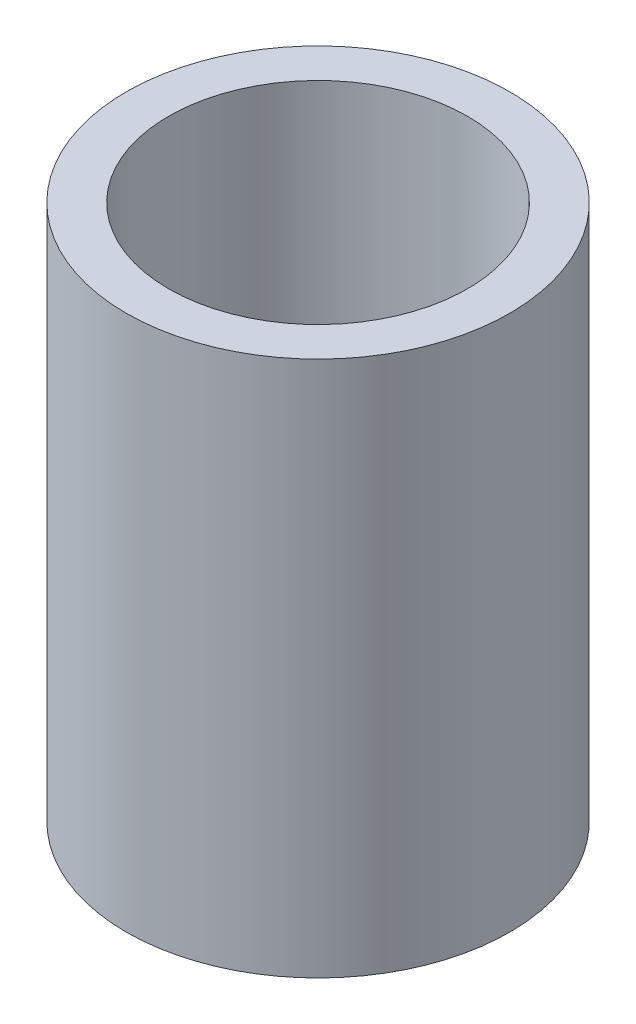
from build123d import *

# Parameters (mm, degrees)
SKETCH1_R           = 22.5
BOSS_EXTRUDE1_DEPTH = 62.876562951
SKETCH2_R           = 17.535425343
CUT_EXTRUDE1_DEPTH  = 71.469583286


with BuildPart() as part:
    # Sketch1 → Boss-Extrude1 (new body)
    with BuildSketch(Plane(origin=(0, 0, 0), x_dir=(1, 0, 0), z_dir=(0, 1, 0))):
        Circle(SKETCH1_R)
    extrude(amount=BOSS_EXTRUDE1_DEPTH)

    # Sketch2 → Cut-Extrude1 (cut, through all)
    with BuildSketch(Plane(origin=(0, 0, 0), x_dir=(1, 0, 0), z_dir=(0, 1, 0))):
        Circle(SKETCH2_R)
    extrude(amount=CUT_EXTRUDE1_DEPTH, mode=Mode.SUBTRACT)


solid = part.part
